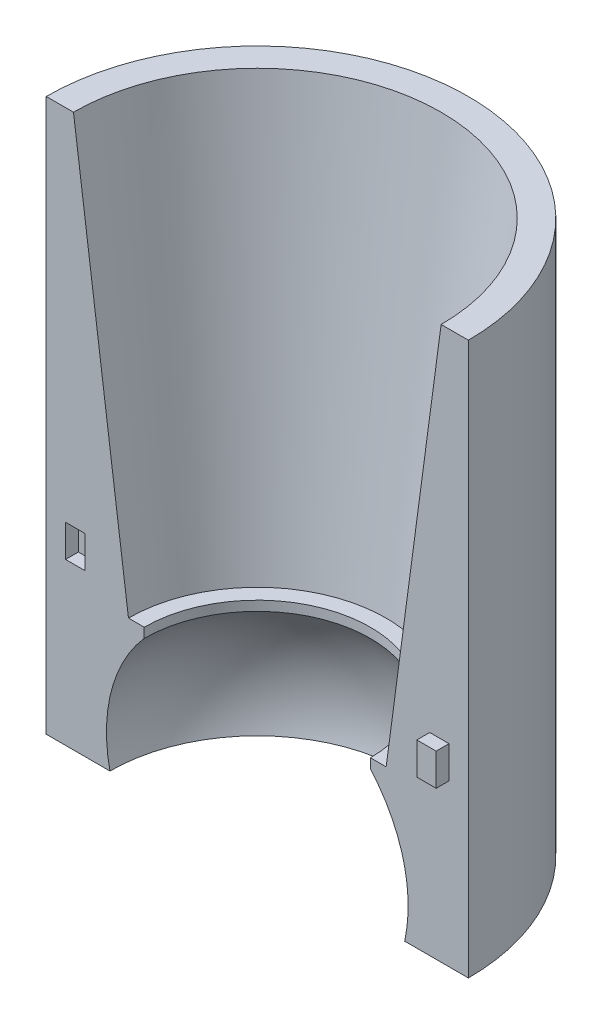
from build123d import *

# Parameters (mm, degrees)
REVOLVE8_ANGLE      = 180
SKETCH5_W           = 3
SKETCH5_H           = 5
BOSS_EXTRUDE1_DEPTH = 2
SKETCH6_W           = 3
SKETCH6_H           = 5
CUT_EXTRUDE1_DEPTH  = 2


with BuildPart() as part:
    # Sketch3 → Revolve8 (revolve)
    with BuildSketch(Plane.XY):
        with BuildLine():
            Line((-29.128306284, 8.200453936), (-37.660231074, 71.93674596))
            Line((-37.660231074, 71.93674596), (-41.890937722, 71.93674596))
            Line((-41.890937722, 71.93674596), (-41.890937722, -13.799546064))
            Line((-41.890937722, -13.799546064), (-32.002803505, -13.799546064))
            ThreePointArc((-32.002803505, -13.799546064), (-31.791307644, -2.914720346), (-26.680397065, 6.6979148))
            Line((-26.680397065, 6.6979148), (-26.680397065, 8.200453936))
            Line((-26.680397065, 8.200453936), (-29.128306284, 8.200453936))
        make_face()
    revolve(axis=Axis((-9.127877823, 95.858464184, 0), (0, -1, 0)), revolution_arc=REVOLVE8_ANGLE)

    # Sketch5 → Boss-Extrude1 (add)
    with BuildSketch(Plane.XY):
        with Locations((19.135182076, 13.700453936)):
            Rectangle(SKETCH5_W, SKETCH5_H)
    extrude(amount=BOSS_EXTRUDE1_DEPTH)

    # Sketch6 → Cut-Extrude1 (cut)
    with BuildSketch(Plane.XY):
        with Locations((-37.390937722, 13.700453936)):
            Rectangle(SKETCH6_W, SKETCH6_H)
    extrude(amount=-CUT_EXTRUDE1_DEPTH, mode=Mode.SUBTRACT)


solid = part.part
